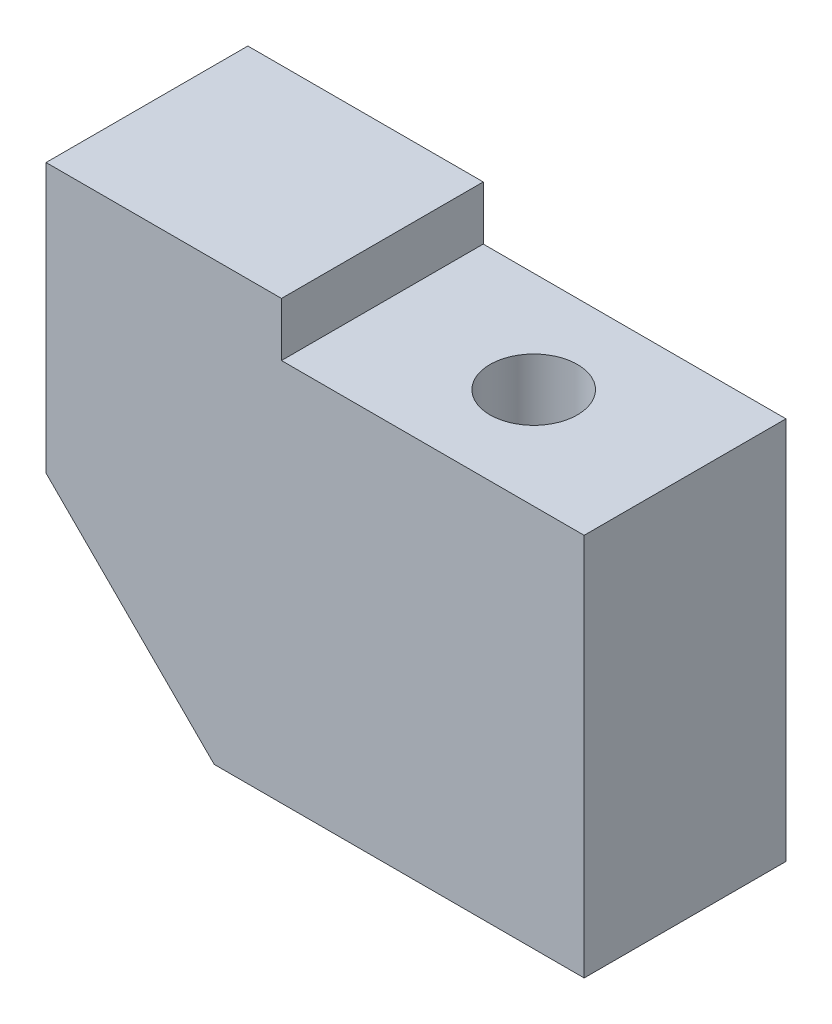
from build123d import *

# Parameters (mm, degrees)
BOSS_EXTRUDE1_DEPTH = 6
SKETCH2_R           = 1.5
CUT_EXTRUDE1_DEPTH  = 9
SKETCH3_R           = 1.3
CUT_EXTRUDE2_DEPTH  = 17.930308645


with BuildPart() as part:
    # Sketch1 → Boss-Extrude1 (new body)
    with BuildSketch(Plane.XY):
        Polygon((-9.035228321, 7.864851207), (-2.035228321, 7.864851207), (-2.035228321, 6.264851207), (6.964771679, 6.264851207), (6.964771679, -5.135148793), (-4.035228321, -5.135148793), (-9.035228321, -0.135148793), align=None)
    extrude(amount=BOSS_EXTRUDE1_DEPTH)

    # Sketch2 → Cut-Extrude1 (cut)
    with BuildSketch(Plane.ZY.offset(9.035228321)):
        with Locations((3, 3.864851207)):
            Circle(SKETCH2_R)
    extrude(amount=-CUT_EXTRUDE1_DEPTH, mode=Mode.SUBTRACT)

    # Sketch3 → Cut-Extrude2 (cut, through all)
    with BuildSketch(Plane(origin=(0, 7.864851207, 0), x_dir=(1, 0, 0), z_dir=(0, 1, 0))):
        with Locations((2.464771679, -3)):
            Circle(SKETCH3_R)
    extrude(amount=-CUT_EXTRUDE2_DEPTH, mode=Mode.SUBTRACT)


solid = part.part
